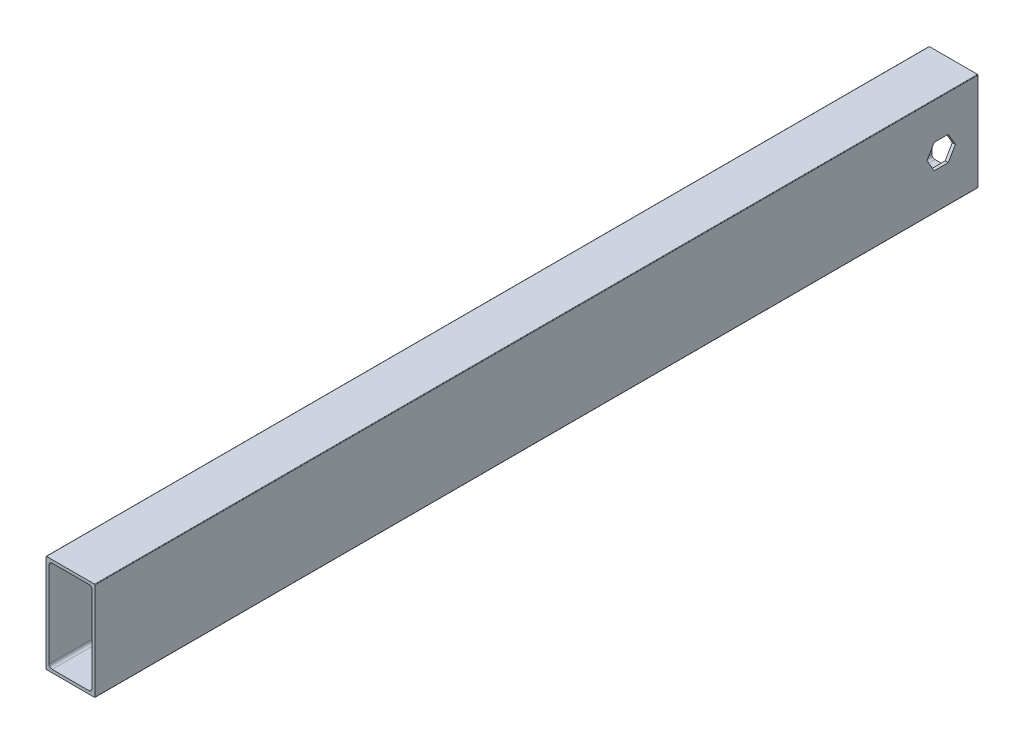
from build123d import *

# Parameters (mm, degrees)
BOSS_EXTRUDE1_DEPTH = 457.2
CUT_EXTRUDE1_DEPTH  = 25.4


with BuildPart() as part:
    # Sketch1 → Boss-Extrude1 (new body)
    with BuildSketch(Plane(origin=(0, 0, 0), x_dir=(-1, 0, 0), z_dir=(0, 0, -1))):
        with BuildLine():
            Line((-12.7, 25.146), (-12.7, -25.146))
            ThreePointArc((-12.7, -25.146), (-12.625605122, -25.325605122), (-12.446, -25.4))
            Line((-12.446, -25.4), (12.446, -25.4))
            ThreePointArc((12.446, -25.4), (12.625605122, -25.325605122), (12.7, -25.146))
            Line((12.7, -25.146), (12.7, 25.146))
            ThreePointArc((12.7, 25.146), (12.625605122, 25.325605122), (12.446, 25.4))
            Line((12.446, 25.4), (-12.446, 25.4))
            ThreePointArc((-12.446, 25.4), (-12.625605122, 25.325605122), (-12.7, 25.146))
        make_face()
        with BuildLine():
            Line((-11.1125, -22.225), (-11.1125, 22.225))
            ThreePointArc((-11.1125, 22.225), (-10.647532015, 23.347532015), (-9.525, 23.8125))
            Line((-9.525, 23.8125), (9.525, 23.8125))
            ThreePointArc((9.525, 23.8125), (10.647532015, 23.347532015), (11.1125, 22.225))
            Line((11.1125, 22.225), (11.1125, -22.225))
            ThreePointArc((11.1125, -22.225), (10.647532015, -23.347532015), (9.525, -23.8125))
            Line((9.525, -23.8125), (-9.525, -23.8125))
            ThreePointArc((-9.525, -23.8125), (-10.647532015, -23.347532015), (-11.1125, -22.225))
        make_face(mode=Mode.SUBTRACT)
    extrude(amount=-BOSS_EXTRUDE1_DEPTH)

    # Sketch2 → Cut-Extrude1 (cut)
    with BuildSketch(Plane.ZY.offset(12.7)):
        Polygon((26.382348419, 0), (22.716174209, 6.35), (15.383825791, 6.35), (11.717651581, 0), (15.383825791, -6.35), (22.716174209, -6.35), align=None)
    extrude(amount=-CUT_EXTRUDE1_DEPTH, mode=Mode.SUBTRACT)


solid = part.part
